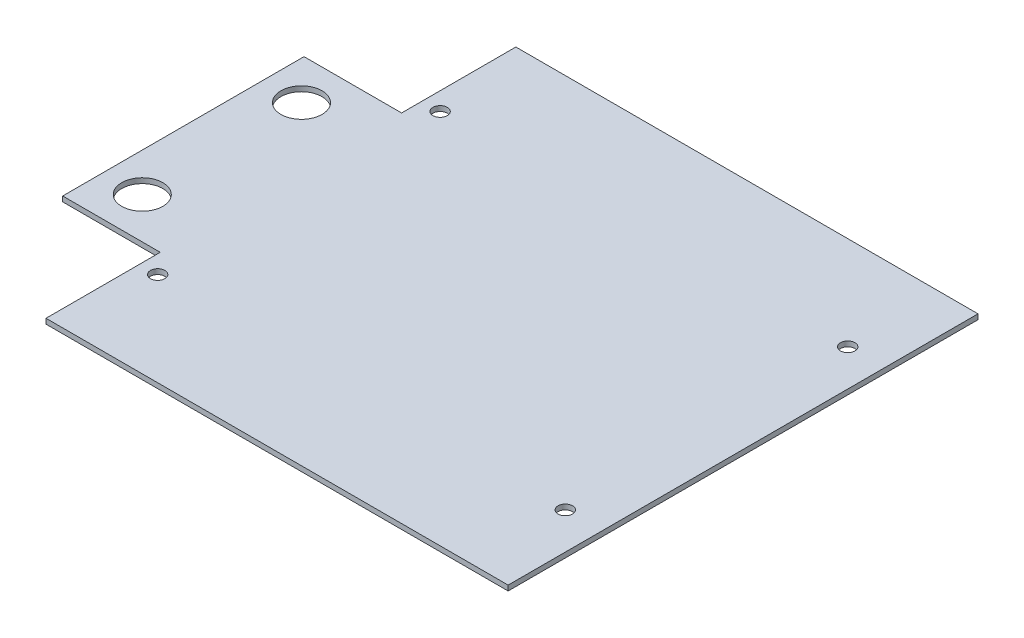
from build123d import *

# Parameters (mm, degrees)
SKETCH1_R          = 2.8
SKETCH1_R_2        = 8
BASE_FLANGE1_DEPTH = 2


# Sheet-metal steps are written as plain solids
with BuildPart() as part:
    # Sketch1 → Base-Flange1 (new body)
    with BuildSketch(Plane(origin=(0, 0, 0), x_dir=(1, 0, 0), z_dir=(0, 1, 0))):
        Polygon((-90, 91.5), (90, 91.5), (90, -91.5), (-90, -91.5), (-90, -47), (-128, -47), (-128, 47), (-90, 47), align=None)
        with Locations(Location((-83, 55.0037, 0), (0, 0, 270))):
            Circle(SKETCH1_R, mode=Mode.SUBTRACT)
        with Locations(Location((-83, -55.0037, 0), (0, 0, 270))):
            Circle(SKETCH1_R, mode=Mode.SUBTRACT)
        with Locations(Location((75.76, -55.0037, 0), (0, 0, 270))):
            Circle(SKETCH1_R, mode=Mode.SUBTRACT)
        with Locations(Location((75.76, 55.0037, 0), (0, 0, 270))):
            Circle(SKETCH1_R, mode=Mode.SUBTRACT)
        with Locations(Location((-113, 31, 0), (0, 0, 270))):
            Circle(SKETCH1_R_2, mode=Mode.SUBTRACT)
        with Locations(Location((-113, -31, 0), (0, 0, 270))):
            Circle(SKETCH1_R_2, mode=Mode.SUBTRACT)
    extrude(amount=-BASE_FLANGE1_DEPTH)


solid = part.part
